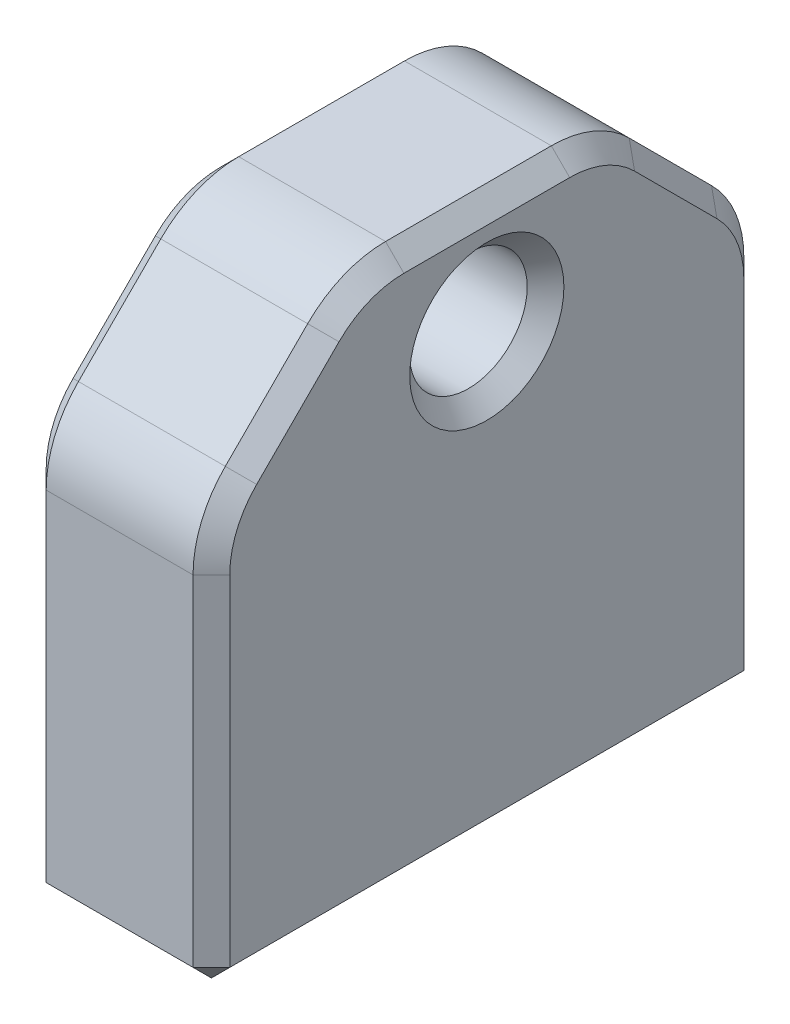
from build123d import *

# Parameters (mm, degrees)
SKETCH1_W           = 6.35
SKETCH1_H           = 19.05
BOSS_EXTRUDE1_DEPTH = 19.05
SKETCH2_R           = 2.032
CUT_EXTRUDE1_DEPTH  = 23.225
SKETCH1_3_R         = 2.032
CUT_EXTRUDE2_DEPTH  = 7.62
CHAMFER1_SIZE       = 5.08
FILLET1_R           = 3.81


with BuildPart() as part:
    # Sketch1 → Boss-Extrude1 (new body)
    with BuildSketch(Plane(origin=(0, 0, 0), x_dir=(1, 0, 0), z_dir=(0, 1, 0))):
        Rectangle(SKETCH1_W, SKETCH1_H)
    extrude(amount=BOSS_EXTRUDE1_DEPTH)

    # Sketch2 → Cut-Extrude1 (cut, through all)
    with BuildSketch(Plane.ZY.offset(3.175)):
        with Locations((0, 15.24)):
            Circle(SKETCH2_R)
    extrude(amount=-CUT_EXTRUDE1_DEPTH, mode=Mode.SUBTRACT)

    # Sketch1<3> → Cut-Extrude2 (cut)
    with BuildSketch(Plane(origin=(0, 0, 0), x_dir=(1, 0, 0), z_dir=(0, 1, 0))):
        with Locations(Location((0, 6.35, 0), (0, 0, 90))):
            Circle(SKETCH1_3_R)
        with Locations(Location((0, -6.35, 0), (0, 0, 90))):
            Circle(SKETCH1_3_R)
    extrude(amount=CUT_EXTRUDE2_DEPTH, mode=Mode.SUBTRACT)

    # Chamfer1
    chamfer1_edges = [part.edges().sort_by_distance(p)[0] for p in [
        (0, 19.05, 9.525),
        (0, 19.05, -9.525),
    ]]
    chamfer(chamfer1_edges, length=CHAMFER1_SIZE)

    # Fillet1
    fillet1_edges = [part.edges().sort_by_distance(p)[0] for p in [
        (0, 19.05, -4.445),
        (0, 19.05, 4.445),
        (0, 13.97, 9.525),
        (0, 13.97, -9.525),
    ]]
    fillet(fillet1_edges, radius=FILLET1_R)

    # Chamfer2
    # the kernel refuses this chamfer: 0.635 mm, written as the material it takes off along each edge
    with BuildSketch(Plane(origin=(2.751666667, 0.423333333, 9.101666667), x_dir=(0.7071067811865476, 0.7071067811865474, 0), z_dir=(0.5773502691896255, -0.5773502691896256, 0.5773502691896261)), Plane(origin=(-2.751666667, 0.423333333, 9.101666667), x_dir=(0.7071067811865476, -0.7071067811865474, 0), z_dir=(-0.5773502691896257, -0.5773502691896258, 0.5773502691896257))) as chamfer2_piece_1:
        Polygon((-0.449012806, -0.259237664), (0.449012806, -0.259237664), (0, 0.518475329), align=None)
    extrude(amount=0.806558326, mode=Mode.SUBTRACT)
    with BuildSketch(Plane(origin=(-2.751666667, 0.423333333, -9.101666667), x_dir=(-0.7071067811865476, 0, 0.7071067811865476), z_dir=(-0.5773502691896258, -0.5773502691896255, -0.5773502691896258)), Plane(origin=(2.751666667, 0.423333333, -9.101666667), x_dir=(0, -0.7071067811865477, 0.7071067811865474), z_dir=(0.5773502691896258, -0.5773502691896255, -0.5773502691896258))) as chamfer2_piece_2:
        Polygon((-0.449012806, 0.259237664), (0.449012806, 0.259237664), (0, -0.518475329), align=None)
    extrude(amount=0.806558326, mode=Mode.SUBTRACT)
    with BuildSketch(Plane(origin=(3.175, 15.24, 0), x_dir=(0, 0, 1), z_dir=(0, -1, 0))) as chamfer2_piece_3:
        with BuildLine():
            Line((2.684960512, -0.017960512), (2.014039488, 0.652960512))
            Line((2.014039488, 0.652960512), (2.001339488, 0.652960512))
            ThreePointArc((2.001339488, 0.652960512), (2.0193, 0.326480256), (2.0193, 0))
            Line((2.0193, 0), (2.032, -0.0127))
            ThreePointArc((2.032, -0.0127), (2.358480256, -0.0127), (2.684960512, -0.030660512))
            Line((2.684960512, -0.030660512), (2.684960512, -0.017960512))
        make_face()
    revolve(axis=Axis((3.175, 15.24, 0), (-1, 0, 0)), mode=Mode.SUBTRACT)
    with BuildSketch(Plane(origin=(-3.175, 15.24, 0), x_dir=(0, 0, 1), z_dir=(0, -1, 0))) as chamfer2_piece_4:
        with BuildLine():
            Line((2.684960512, 0.017960512), (2.014039488, -0.652960512))
            Line((2.014039488, -0.652960512), (2.001339488, -0.652960512))
            ThreePointArc((2.001339488, -0.652960512), (2.0193, -0.326480256), (2.0193, 0))
            Line((2.0193, 0), (2.032, 0.0127))
            ThreePointArc((2.032, 0.0127), (2.358480256, 0.0127), (2.684960512, 0.030660512))
            Line((2.684960512, 0.030660512), (2.684960512, 0.017960512))
        make_face()
    revolve(axis=Axis((-3.175, 15.24, 0), (-1, 0, 0)), mode=Mode.SUBTRACT)
    with BuildSketch(Plane(origin=(0, 0, -6.35), x_dir=(0, 0, -1), z_dir=(1, 0, 0))) as chamfer2_piece_5:
        with BuildLine():
            Line((2.684960512, -0.017960512), (2.014039488, 0.652960512))
            Line((2.014039488, 0.652960512), (2.001339488, 0.652960512))
            ThreePointArc((2.001339488, 0.652960512), (2.0193, 0.326480256), (2.0193, 0))
            Line((2.0193, 0), (2.032, -0.0127))
            ThreePointArc((2.032, -0.0127), (2.358480256, -0.0127), (2.684960512, -0.030660512))
            Line((2.684960512, -0.030660512), (2.684960512, -0.017960512))
        make_face()
    revolve(axis=Axis((0, 0, -6.35), (0, 1, 0)), mode=Mode.SUBTRACT)
    with BuildSketch(Plane(origin=(0, 0, 6.35), x_dir=(0, 0, -1), z_dir=(1, 0, 0))) as chamfer2_piece_6:
        with BuildLine():
            Line((2.684960512, -0.017960512), (2.014039488, 0.652960512))
            Line((2.014039488, 0.652960512), (2.001339488, 0.652960512))
            ThreePointArc((2.001339488, 0.652960512), (2.0193, 0.326480256), (2.0193, 0))
            Line((2.0193, 0), (2.032, -0.0127))
            ThreePointArc((2.032, -0.0127), (2.358480256, -0.0127), (2.684960512, -0.030660512))
            Line((2.684960512, -0.030660512), (2.684960512, -0.017960512))
        make_face()
    revolve(axis=Axis((0, 0, 6.35), (0, 1, 0)), mode=Mode.SUBTRACT)
    with BuildSketch(Plane(origin=(3.175, -1.633018697, 9.525), x_dir=(0.027495876610586664, 0, -0.9996219169112968), z_dir=(0, 1, 0)), Plane(origin=(3.175, -1.633018697, -9.525), x_dir=(-0.9996219169112968, 0, -0.027495876610587288), z_dir=(0, 1, 0))) as chamfer2_piece_7:
        with BuildLine():
            Line((0.653207479, 0), (-0.035907443, 0.652219799))
            Line((-0.035907443, 0.652219799), (-0.048602642, 0.651870601))
            ThreePointArc((-0.048602642, 0.651870601), (-0.021672059, 0.326007622), (-0.012695198, -0.000349198))
            Line((-0.012695198, -0.000349198), (0.000349198, -0.012695198))
            ThreePointArc((0.000349198, -0.012695198), (0.326706017, -0.003718338), (0.653556677, -0.012695198))
            Line((0.653556677, -0.012695198), (0.653207479, 0))
        make_face()
    extrude(amount=14.024865025, mode=Mode.SUBTRACT)
    with BuildSketch(Plane(origin=(-3.175, -1.633018697, 9.525), x_dir=(-0.02749587661058659, 0, -0.9996219169112968), z_dir=(0, 1, 0)), Plane(origin=(-3.175, -1.633018697, -9.525), x_dir=(0.9996219169112968, 0, -0.027495876610587288), z_dir=(0, 1, 0))) as chamfer2_piece_8:
        with BuildLine():
            Line((0.653207479, 0), (-0.035907443, -0.652219799))
            Line((-0.035907443, -0.652219799), (-0.048602642, -0.651870601))
            ThreePointArc((-0.048602642, -0.651870601), (-0.021672059, -0.326007622), (-0.012695198, 0.000349198))
            Line((-0.012695198, 0.000349198), (0.000349198, 0.012695198))
            ThreePointArc((0.000349198, 0.012695198), (0.326706017, 0.003718338), (0.653556677, 0.012695198))
            Line((0.653556677, 0.012695198), (0.653207479, 0))
        make_face()
    extrude(amount=14.024865025, mode=Mode.SUBTRACT)
    with BuildSketch(Plane(origin=(-3.175, 17.934076836, 5.560923164), x_dir=(-0.027495876610585324, -0.7068394360706735, -0.7068394360706735), z_dir=(0, -0.7071067811865476, 0.7071067811865476)), Plane(origin=(-3.175, 15.085923164, -8.409076836), x_dir=(-0.027495876610586552, -0.7068394360706735, 0.7068394360706735), z_dir=(0, 0.7071067811865476, 0.7071067811865476))) as chamfer2_piece_9:
        with BuildLine():
            Line((0.653207479, 0), (-0.035907443, 0.652219799))
            Line((-0.035907443, 0.652219799), (-0.048602642, 0.651870601))
            ThreePointArc((-0.048602642, 0.651870601), (-0.021672059, 0.326007622), (-0.012695198, -0.000349198))
            Line((-0.012695198, -0.000349198), (0.000349198, -0.012695198))
            ThreePointArc((0.000349198, -0.012695198), (0.326706017, -0.003718338), (0.653556677, -0.012695198))
            Line((0.653556677, -0.012695198), (0.653207479, 0))
        make_face()
    extrude(amount=4.027897552, mode=Mode.SUBTRACT)
    with BuildSketch(Plane(origin=(-3.175, 19.05, 2.866846327), x_dir=(-0.02749587661058659, -0.9996219169112968, 0), z_dir=(0, 0, -1)), Plane(origin=(3.175, 19.05, -2.866846327), x_dir=(0.02749587661058659, -0.9996219169112968, 0), z_dir=(0, 0, 1))) as chamfer2_piece_10:
        with BuildLine():
            Line((0.653207479, 0), (-0.035907443, -0.652219799))
            Line((-0.035907443, -0.652219799), (-0.048602642, -0.651870601))
            ThreePointArc((-0.048602642, -0.651870601), (-0.021672059, -0.326007622), (-0.012695198, 0.000349198))
            Line((-0.012695198, 0.000349198), (0.000349198, 0.012695198))
            ThreePointArc((0.000349198, 0.012695198), (0.326706017, 0.003718338), (0.653556677, 0.012695198))
            Line((0.653556677, 0.012695198), (0.653207479, 0))
        make_face()
    extrude(amount=5.733692655, mode=Mode.SUBTRACT)
    with BuildSketch(Plane(origin=(-3.175, 15.24, -2.866846327), x_dir=(0, 0.7071067811865476, -0.7071067811865474), z_dir=(0, -0.7071067811865474, -0.7071067811865476))) as chamfer2_piece_11:
        with BuildLine():
            Line((3.157039488, -0.017960512), (3.827960512, 0.652960512))
            Line((3.827960512, 0.652960512), (3.840660512, 0.652960512))
            ThreePointArc((3.840660512, 0.652960512), (3.8227, 0.326480256), (3.8227, 0))
            Line((3.8227, 0), (3.81, -0.0127))
            ThreePointArc((3.81, -0.0127), (3.483519744, -0.0127), (3.157039488, -0.030660512))
            Line((3.157039488, -0.030660512), (3.157039488, -0.017960512))
        make_face()
    revolve(axis=Axis((-3.175, 15.24, -2.866846327), (1, 0, 0)), revolution_arc=45, mode=Mode.SUBTRACT)
    with BuildSketch(Plane(origin=(-3.175, 12.391846327, -5.715), x_dir=(0, 0, -1), z_dir=(0, -1, 0))) as chamfer2_piece_12:
        with BuildLine():
            Line((3.157039488, -0.017960512), (3.827960512, 0.652960512))
            Line((3.827960512, 0.652960512), (3.840660512, 0.652960512))
            ThreePointArc((3.840660512, 0.652960512), (3.8227, 0.326480256), (3.8227, 0))
            Line((3.8227, 0), (3.81, -0.0127))
            ThreePointArc((3.81, -0.0127), (3.483519744, -0.0127), (3.157039488, -0.030660512))
            Line((3.157039488, -0.030660512), (3.157039488, -0.017960512))
        make_face()
    revolve(axis=Axis((-3.175, 12.391846327, -5.715), (1, 0, 0)), revolution_arc=45, mode=Mode.SUBTRACT)
    with BuildSketch(Plane(origin=(-3.175, 15.24, 2.866846327), x_dir=(0, 0.7071067811865476, 0.7071067811865474), z_dir=(0, -0.7071067811865474, 0.7071067811865476))) as chamfer2_piece_13:
        with BuildLine():
            Line((3.157039488, 0.017960512), (3.827960512, -0.652960512))
            Line((3.827960512, -0.652960512), (3.840660512, -0.652960512))
            ThreePointArc((3.840660512, -0.652960512), (3.8227, -0.326480256), (3.8227, 0))
            Line((3.8227, 0), (3.81, 0.0127))
            ThreePointArc((3.81, 0.0127), (3.483519744, 0.0127), (3.157039488, 0.030660512))
            Line((3.157039488, 0.030660512), (3.157039488, 0.017960512))
        make_face()
    revolve(axis=Axis((-3.175, 15.24, 2.866846327), (-1, 0, 0)), revolution_arc=45, mode=Mode.SUBTRACT)
    with BuildSketch(Plane(origin=(-3.175, 12.391846327, 5.715), x_dir=(0, 0, 1), z_dir=(0, -1, 0))) as chamfer2_piece_14:
        with BuildLine():
            Line((3.157039488, 0.017960512), (3.827960512, -0.652960512))
            Line((3.827960512, -0.652960512), (3.840660512, -0.652960512))
            ThreePointArc((3.840660512, -0.652960512), (3.8227, -0.326480256), (3.8227, 0))
            Line((3.8227, 0), (3.81, 0.0127))
            ThreePointArc((3.81, 0.0127), (3.483519744, 0.0127), (3.157039488, 0.030660512))
            Line((3.157039488, 0.030660512), (3.157039488, 0.017960512))
        make_face()
    revolve(axis=Axis((-3.175, 12.391846327, 5.715), (-1, 0, 0)), revolution_arc=45, mode=Mode.SUBTRACT)
    with BuildSketch(Plane(origin=(3.175, 17.934076836, 5.560923164), x_dir=(0.02749587661058674, -0.7068394360706736, -0.7068394360706736), z_dir=(0, -0.7071067811865476, 0.7071067811865476)), Plane(origin=(3.175, 15.085923164, -8.409076836), x_dir=(0.027495876610585872, -0.7068394360706735, 0.7068394360706735), z_dir=(0, 0.7071067811865476, 0.7071067811865476))) as chamfer2_piece_15:
        with BuildLine():
            Line((0.653207479, 0), (-0.035907443, -0.652219799))
            Line((-0.035907443, -0.652219799), (-0.048602642, -0.651870601))
            ThreePointArc((-0.048602642, -0.651870601), (-0.021672059, -0.326007622), (-0.012695198, 0.000349198))
            Line((-0.012695198, 0.000349198), (0.000349198, 0.012695198))
            ThreePointArc((0.000349198, 0.012695198), (0.326706017, 0.003718338), (0.653556677, 0.012695198))
            Line((0.653556677, 0.012695198), (0.653207479, 0))
        make_face()
    extrude(amount=4.027897552, mode=Mode.SUBTRACT)
    with BuildSketch(Plane(origin=(-3.175, 0, 11.158018697), x_dir=(-0.027495876610586605, 0.9996219169112968, 0), z_dir=(0, 0, -1))) as chamfer2_piece_16:
        with BuildLine():
            Line((0.653207479, 0), (-0.035907443, 0.652219799))
            Line((-0.035907443, 0.652219799), (-0.048602642, 0.651870601))
            ThreePointArc((-0.048602642, 0.651870601), (-0.021672059, 0.326007622), (-0.012695198, -0.000349198))
            Line((-0.012695198, -0.000349198), (0.000349198, -0.012695198))
            ThreePointArc((0.000349198, -0.012695198), (0.326706017, -0.003718338), (0.653556677, -0.012695198))
            Line((0.653556677, -0.012695198), (0.653207479, 0))
        make_face()
    extrude(amount=22.316037395, mode=Mode.SUBTRACT)
    with BuildSketch(Plane(origin=(3.175, 15.24, -2.866846327), x_dir=(0, 0.7071067811865476, -0.7071067811865474), z_dir=(0, -0.7071067811865474, -0.7071067811865476))) as chamfer2_piece_17:
        with BuildLine():
            Line((3.157039488, 0.017960512), (3.827960512, -0.652960512))
            Line((3.827960512, -0.652960512), (3.840660512, -0.652960512))
            ThreePointArc((3.840660512, -0.652960512), (3.8227, -0.326480256), (3.8227, 0))
            Line((3.8227, 0), (3.81, 0.0127))
            ThreePointArc((3.81, 0.0127), (3.483519744, 0.0127), (3.157039488, 0.030660512))
            Line((3.157039488, 0.030660512), (3.157039488, 0.017960512))
        make_face()
    revolve(axis=Axis((3.175, 15.24, -2.866846327), (1, 0, 0)), revolution_arc=45, mode=Mode.SUBTRACT)
    with BuildSketch(Plane(origin=(3.175, 12.391846327, -5.715), x_dir=(0, 0, -1), z_dir=(0, -1, 0))) as chamfer2_piece_18:
        with BuildLine():
            Line((3.827960512, -0.652960512), (3.157039488, 0.017960512))
            Line((3.157039488, 0.017960512), (3.157039488, 0.030660512))
            ThreePointArc((3.157039488, 0.030660512), (3.483519744, 0.0127), (3.81, 0.0127))
            Line((3.81, 0.0127), (3.8227, 0))
            ThreePointArc((3.8227, 0), (3.8227, -0.326480256), (3.840660512, -0.652960512))
            Line((3.840660512, -0.652960512), (3.827960512, -0.652960512))
        make_face()
    revolve(axis=Axis((3.175, 12.391846327, -5.715), (1, 0, 0)), revolution_arc=45, mode=Mode.SUBTRACT)
    with BuildSketch(Plane(origin=(3.175, 15.24, 2.866846327), x_dir=(0, 0.7071067811865476, 0.7071067811865474), z_dir=(0, -0.7071067811865474, 0.7071067811865476))) as chamfer2_piece_19:
        with BuildLine():
            Line((3.157039488, -0.017960512), (3.827960512, 0.652960512))
            Line((3.827960512, 0.652960512), (3.840660512, 0.652960512))
            ThreePointArc((3.840660512, 0.652960512), (3.8227, 0.326480256), (3.8227, 0))
            Line((3.8227, 0), (3.81, -0.0127))
            ThreePointArc((3.81, -0.0127), (3.483519744, -0.0127), (3.157039488, -0.030660512))
            Line((3.157039488, -0.030660512), (3.157039488, -0.017960512))
        make_face()
    revolve(axis=Axis((3.175, 15.24, 2.866846327), (-1, 0, 0)), revolution_arc=45, mode=Mode.SUBTRACT)
    with BuildSketch(Plane(origin=(3.175, 12.391846327, 5.715), x_dir=(0, 0, 1), z_dir=(0, -1, 0))) as chamfer2_piece_20:
        with BuildLine():
            Line((3.157039488, -0.017960512), (3.827960512, 0.652960512))
            Line((3.827960512, 0.652960512), (3.840660512, 0.652960512))
            ThreePointArc((3.840660512, 0.652960512), (3.8227, 0.326480256), (3.8227, 0))
            Line((3.8227, 0), (3.81, -0.0127))
            ThreePointArc((3.81, -0.0127), (3.483519744, -0.0127), (3.157039488, -0.030660512))
            Line((3.157039488, -0.030660512), (3.157039488, -0.017960512))
        make_face()
    revolve(axis=Axis((3.175, 12.391846327, 5.715), (-1, 0, 0)), revolution_arc=45, mode=Mode.SUBTRACT)
    with BuildSketch(Plane(origin=(4.808018697, 0, 9.525), x_dir=(0, -0.02749587661058637, -0.9996219169112968), z_dir=(-1, 0, 0))) as chamfer2_piece_21:
        with BuildLine():
            Line((0.653207479, 0), (-0.035907443, -0.652219799))
            Line((-0.035907443, -0.652219799), (-0.048602642, -0.651870601))
            ThreePointArc((-0.048602642, -0.651870601), (-0.021672059, -0.326007622), (-0.012695198, 0.000349198))
            Line((-0.012695198, 0.000349198), (0.000349198, 0.012695198))
            ThreePointArc((0.000349198, 0.012695198), (0.326706017, 0.003718338), (0.653556677, 0.012695198))
            Line((0.653556677, 0.012695198), (0.653207479, 0))
        make_face()
    extrude(amount=9.616037395, mode=Mode.SUBTRACT)
    with BuildSketch(Plane(origin=(3.175, 0, -11.158018697), x_dir=(-0.9996219169112968, -0.02749587661058635, 0), z_dir=(0, 0, 1))) as chamfer2_piece_22:
        with BuildLine():
            Line((0.653207479, 0), (-0.035907443, -0.652219799))
            Line((-0.035907443, -0.652219799), (-0.048602642, -0.651870601))
            ThreePointArc((-0.048602642, -0.651870601), (-0.021672059, -0.326007622), (-0.012695198, 0.000349198))
            Line((-0.012695198, 0.000349198), (0.000349198, 0.012695198))
            ThreePointArc((0.000349198, 0.012695198), (0.326706017, 0.003718338), (0.653556677, 0.012695198))
            Line((0.653556677, 0.012695198), (0.653207479, 0))
        make_face()
    extrude(amount=22.316037395, mode=Mode.SUBTRACT)
    with BuildSketch(Plane(origin=(-4.808018697, 0, -9.525), x_dir=(0, 0.9996219169112966, -0.02749587661058728), z_dir=(1, 0, 0))) as chamfer2_piece_23:
        with BuildLine():
            Line((0.653207479, 0), (-0.035907443, 0.652219799))
            Line((-0.035907443, 0.652219799), (-0.048602642, 0.651870601))
            ThreePointArc((-0.048602642, 0.651870601), (-0.021672059, 0.326007622), (-0.012695198, -0.000349198))
            Line((-0.012695198, -0.000349198), (0.000349198, -0.012695198))
            ThreePointArc((0.000349198, -0.012695198), (0.326706017, -0.003718338), (0.653556677, -0.012695198))
            Line((0.653556677, -0.012695198), (0.653207479, 0))
        make_face()
    extrude(amount=9.616037395, mode=Mode.SUBTRACT)


solid = part.part
